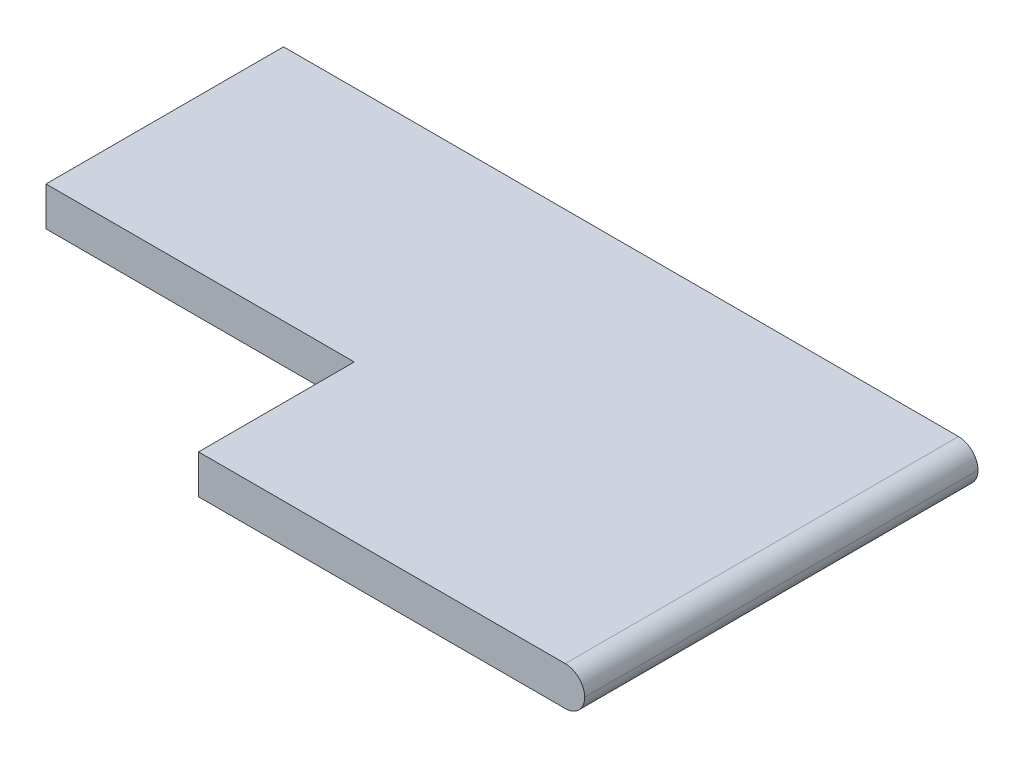
from build123d import *

# Parameters (mm, degrees)
SKETCH1_W           = 53.5
SKETCH1_H           = 3
BOSS_EXTRUDE1_DEPTH = 30.3
SKETCH2_W           = 23.75
SKETCH2_H           = 3
CUT_EXTRUDE1_DEPTH  = 12
FILLET1_R           = 1.5


with BuildPart() as part:
    # Sketch1 → Boss-Extrude1 (new body)
    with BuildSketch(Plane.XY):
        with Locations((22.5, 0)):
            Rectangle(SKETCH1_W, SKETCH1_H)
    extrude(amount=BOSS_EXTRUDE1_DEPTH)

    # Sketch2 → Cut-Extrude1 (cut)
    with BuildSketch(Plane.XY.offset(30.3)):
        with Locations((7.625, 0)):
            Rectangle(SKETCH2_W, SKETCH2_H)
    extrude(amount=-CUT_EXTRUDE1_DEPTH, mode=Mode.SUBTRACT)

    # Fillet1
    fillet1_edges = [part.edges().sort_by_distance(p)[0] for p in [
        (49.25, -1.5, 15.15),
        (49.25, 1.5, 15.15),
    ]]
    fillet(fillet1_edges, radius=FILLET1_R - 0.0001)  # a hair under: the kernel refuses the full size


solid = part.part
